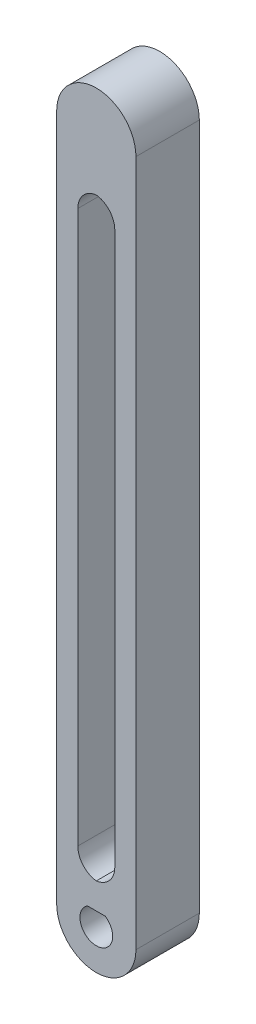
from build123d import *

# Parameters (mm, degrees)
BOSS_EXTRUDE1_DEPTH = 12
SKETCH2_R           = 3.1
BOSS_EXTRUDE2_DEPTH = 15
CUT_EXTRUDE1_START  = -50
CUT_EXTRUDE1_DEPTH  = 50
CUT_EXTRUDE2_START  = -15
CUT_EXTRUDE2_DEPTH  = 15
SKETCH5_W           = 7
SKETCH5_H           = 112.5
CUT_EXTRUDE3_DEPTH  = 12
SKETCH6_R           = 5.15
CUT_EXTRUDE4_DEPTH  = 2
FILLET1_R           = 4


with BuildPart() as part:
    # Sketch1 → Boss-Extrude1 (new body)
    with BuildSketch(Plane.XY):
        with BuildLine():
            Line((-5.64516129, 102.580645161), (-5.64516129, -27.419354839))
            ThreePointArc((-5.64516129, -27.419354839), (1.85483871, -34.919354839), (9.35483871, -27.419354839))
            Line((9.35483871, -27.419354839), (9.35483871, 102.580645161))
            ThreePointArc((9.35483871, 102.580645161), (1.85483871, 110.080645161), (-5.64516129, 102.580645161))
        make_face()
    extrude(amount=BOSS_EXTRUDE1_DEPTH)

    # Sketch2 → Boss-Extrude2 (add)
    with BuildSketch(Plane.XY.offset(12)):
        with Locations(Location((1.85483871, -27.419354839, 0), (0, 0, 180))):
            Circle(SKETCH2_R)
    extrude(amount=BOSS_EXTRUDE2_DEPTH)

    # Sketch3 → Cut-Extrude1 (cut)
    with BuildSketch(Plane.XY.offset(27).offset(CUT_EXTRUDE1_START)):
        with BuildLine():
            Line((0.166644408, -24.819354839), (3.543033011, -24.819354839))
            ThreePointArc((3.543033011, -24.819354839), (1.85483871, -30.519354839), (0.166644408, -24.819354839))
        make_face()
    extrude(amount=CUT_EXTRUDE1_DEPTH, mode=Mode.SUBTRACT)

    # Sketch4 → Cut-Extrude2 (cut)
    with BuildSketch(Plane.XY.offset(27).offset(CUT_EXTRUDE2_START)):
        with BuildLine():
            Line((0.166644408, -24.819354839), (3.543033011, -24.819354839))
            ThreePointArc((3.543033011, -24.819354839), (1.85483871, -24.319354839), (0.166644408, -24.819354839))
        make_face()
    extrude(amount=CUT_EXTRUDE2_DEPTH, mode=Mode.SUBTRACT)

    # Sketch5 → Cut-Extrude3 (cut)
    with BuildSketch(Plane.XY.offset(12)):
        with Locations((1.85483871, 36.330645161)):
            Rectangle(SKETCH5_W, SKETCH5_H)
    extrude(amount=-CUT_EXTRUDE3_DEPTH, mode=Mode.SUBTRACT)

    # Sketch6 → Cut-Extrude4 (cut)
    with BuildSketch(Plane.ZY.offset(5.64516129)):
        with Locations(Location((6, 78.768969581, 0), (0, 0, 270))):
            Circle(SKETCH6_R)
        with Locations(Location((6, 53.768969581, 0), (0, 0, 270))):
            Circle(SKETCH6_R)
        with Locations(Location((6, 28.768969581, 0), (0, 0, 270))):
            Circle(SKETCH6_R)
    extrude(amount=-CUT_EXTRUDE4_DEPTH, mode=Mode.SUBTRACT)

    # Fillet1
    # the kernel refuses this fillet: 4 mm, written as the material it adds along each edge
    with BuildSketch(Plane(origin=(-1.64516129, -19.919354839, 12), x_dir=(0, 1, 0), z_dir=(0, 0, -1)), Plane(origin=(5.35483871, -19.919354839, 12), x_dir=(-1, 0, 0), z_dir=(0, 0, -1)), Plane(origin=(5.35483871, 92.580645161, 12), x_dir=(0, -1, 0), z_dir=(0, 0, -1))) as fillet1_piece_1:
        with BuildLine():
            CenterArc((FILLET1_R, FILLET1_R), FILLET1_R, 180, 90)
            Line((0, FILLET1_R), (0, 0))
            Line((0, 0), (FILLET1_R, 0))
        make_face()
    extrude(amount=12)
    with BuildSketch(Plane(origin=(-1.64516129, 92.580645161, 12), x_dir=(0, -1, 0), z_dir=(0, 0, -1))) as fillet1_piece_2:
        with BuildLine():
            CenterArc((FILLET1_R, -FILLET1_R), FILLET1_R, 90, 90)
            Line((0, -FILLET1_R), (0, 0))
            Line((0, 0), (FILLET1_R, 0))
        make_face()
    extrude(amount=12)


solid = part.part
